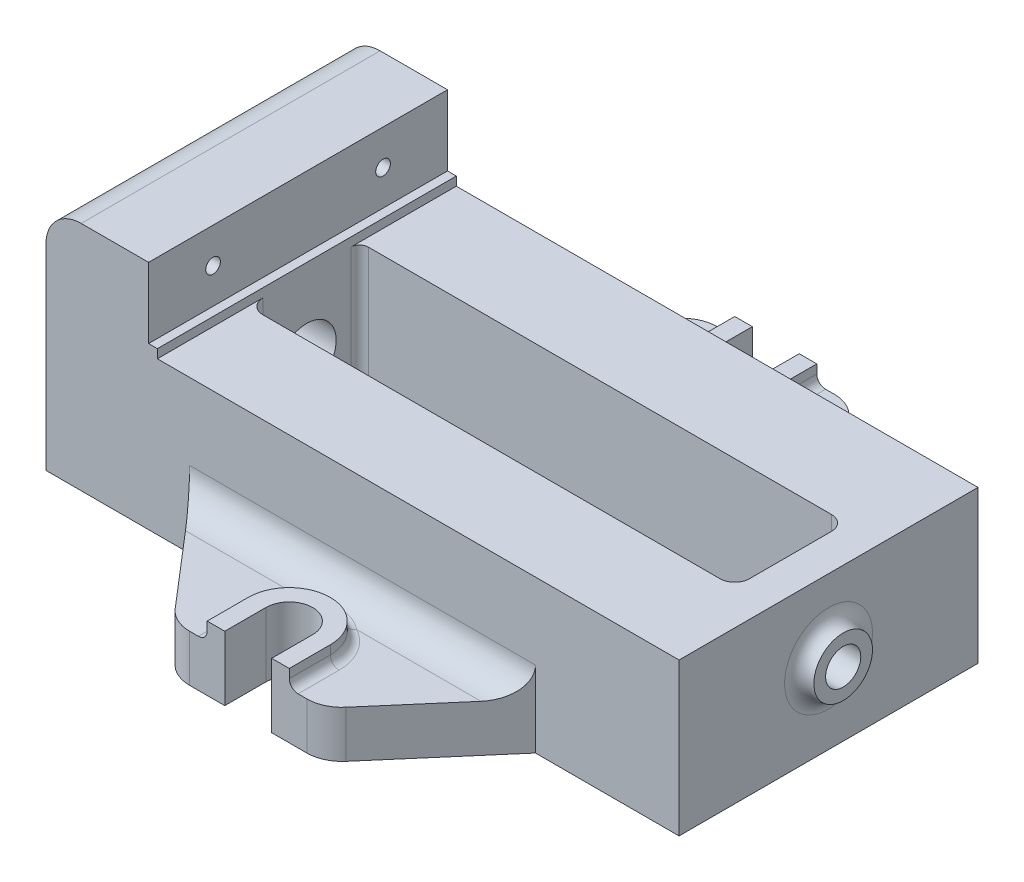
from build123d import *

# Parameters (mm, degrees)
SKETCH1_W             = 216
SKETCH1_H             = 102
EXTRUDE1_DEPTH        = 79
EXTRUDE2_DEPTH        = 169.25278601
FILLET1_R             = 12
EXTRUDE3_DEPTH        = 131.265114286
EXTRUDE4_DEPTH        = 16
EXTRUDE5_DEPTH        = 6
FILLET3_R             = 10
FILLET4_R             = 3
FILLET5_R             = 10
FILLET6_R             = 3
M6_TAPPED_HOLE1_D     = 5
M6_TAPPED_HOLE1_DEPTH = 14
M6_TAPPED_HOLE1_TIP   = 1.502151548
SKETCH13_R            = 10
SKETCH13_R_2          = 6
EXTRUDE7_DEPTH        = 5
EXTRUDE8_REACH        = 248.976
SKETCH14_R            = 6
FILLET7_R             = 5
SKETCH15_R            = 16
EXTRUDE9_DEPTH        = 5
EXTRUDE10_REACH       = 257.767
SKETCH16_R            = 10
EXTRUDE11_DEPTH       = 12


with BuildPart() as part:
    # Sketch1 → Extrude1 (new body)
    with BuildSketch(Plane(origin=(0, 0, 0), x_dir=(1, 0, 0), z_dir=(0, 1, 0))):
        Rectangle(SKETCH1_W, SKETCH1_H)
    extrude(amount=EXTRUDE1_DEPTH)

    # Sketch2 → Extrude2 (cut, through all)
    with BuildSketch(Plane.XY.offset(51)):
        Polygon((-73, 79), (-73, 55), (-70, 55), (-70, 52), (108, 52), (108, 79), align=None)
    extrude(amount=-EXTRUDE2_DEPTH, mode=Mode.SUBTRACT)

    # Fillet1
    fillet1_edges = [part.edges().sort_by_distance(p)[0] for p in [
        (-108, 79, 0),
    ]]
    fillet(fillet1_edges, radius=FILLET1_R)

    # Sketch3 → Extrude3 (cut, through all)
    with BuildSketch(Plane(origin=(0, 52, 0), x_dir=(1, 0, 0), z_dir=(0, 1, 0))):
        with BuildLine():
            Line((-65, -20), (91, -20))
            ThreePointArc((91, -20), (94.535533906, -18.535533906), (96, -15))
            Line((96, -15), (96, 13))
            ThreePointArc((96, 13), (94.535533906, 16.535533906), (91, 18))
            Line((91, 18), (-67, 18))
            ThreePointArc((-67, 18), (-69.121320344, 17.121320344), (-70, 15))
            Line((-70, 15), (-70, -15))
            ThreePointArc((-70, -15), (-68.535533906, -18.535533906), (-65, -20))
        make_face()
    extrude(amount=-EXTRUDE3_DEPTH, mode=Mode.SUBTRACT)

    # Sketch4 → Extrude4 (add)
    with BuildSketch(Plane(origin=(0, 0, 0), x_dir=(1, 0, 0), z_dir=(0, 1, 0))):
        with BuildLine():
            Line((-8, 90), (-20, 90))
            ThreePointArc((-20, 90), (-25.00957212, 88.904319657), (-29.10432929, 85.817364529))
            Line((-29.10432929, 85.817364529), (-59, 51))
            Line((-59, 51), (59, 51))
            Line((59, 51), (29.10432929, 85.817364529))
            ThreePointArc((29.10432929, 85.817364529), (25.00957212, 88.904319657), (20, 90))
            Line((20, 90), (8, 90))
            Line((8, 90), (8, 76))
            ThreePointArc((8, 76), (0, 68), (-8, 76))
            Line((-8, 76), (-8, 90))
        make_face()
        with BuildLine():
            Line((8, -90), (8, -76))
            ThreePointArc((8, -76), (0, -68), (-8, -76))
            Line((-8, -76), (-8, -90))
            Line((-8, -90), (-20, -90))
            ThreePointArc((-20, -90), (-25.00957212, -88.904319657), (-29.10432929, -85.817364529))
            Line((-29.10432929, -85.817364529), (-59, -51))
            Line((-59, -51), (59, -51))
            Line((59, -51), (29.10432929, -85.817364529))
            ThreePointArc((29.10432929, -85.817364529), (25.00957212, -88.904319657), (20, -90))
            Line((20, -90), (8, -90))
        make_face()
    extrude(amount=EXTRUDE4_DEPTH)

    # Sketch5 → Extrude5 (add)
    with BuildSketch(Plane(origin=(0, 16, 0), x_dir=(1, 0, 0), z_dir=(0, 1, 0))):
        with BuildLine():
            Line((-14, -90), (-14, -76))
            ThreePointArc((-14, -76), (0, -62), (14, -76))
            Line((14, -76), (14, -90))
            Line((14, -90), (8, -90))
            Line((8, -90), (8, -76))
            ThreePointArc((8, -76), (0, -68), (-8, -76))
            Line((-8, -76), (-8, -90))
            Line((-8, -90), (-14, -90))
        make_face()
        with BuildLine():
            Line((14, 90), (14, 76))
            ThreePointArc((14, 76), (0, 62), (-14, 76))
            Line((-14, 76), (-14, 90))
            Line((-14, 90), (-8, 90))
            Line((-8, 90), (-8, 76))
            ThreePointArc((-8, 76), (0, 68), (8, 76))
            Line((8, 76), (8, 90))
            Line((8, 90), (14, 90))
        make_face()
    extrude(amount=EXTRUDE5_DEPTH)

    # Fillet3
    fillet3_edges = [part.edges().sort_by_distance(p)[0] for p in [
        (0, 16, 51),
    ]]
    fillet(fillet3_edges, radius=FILLET3_R)

    # Fillet4
    fillet4_edges = [part.edges().sort_by_distance(p)[0] for p in [
        (14, 16, 83),
        (0, 16, 62),
        (-14, 16, 83),
    ]]
    fillet(fillet4_edges, radius=FILLET4_R)

    # Fillet5
    fillet5_edges = [part.edges().sort_by_distance(p)[0] for p in [
        (0, 16, -51),
    ]]
    fillet(fillet5_edges, radius=FILLET5_R)

    # Fillet6
    fillet6_edges = [part.edges().sort_by_distance(p)[0] for p in [
        (0, 16, -62),
        (14, 16, -83),
        (-14, 16, -83),
    ]]
    fillet(fillet6_edges, radius=FILLET6_R)

    # M6 Tapped Hole1
    with Locations(Plane(origin=(-73, 67, 29), x_dir=(0, 0, 1), z_dir=(1, 0, 0))):
        with Locations((0, 0), (-58, 0)):
            Hole(M6_TAPPED_HOLE1_D / 2, depth=M6_TAPPED_HOLE1_DEPTH)
            with Locations((0, 0, -(M6_TAPPED_HOLE1_DEPTH + M6_TAPPED_HOLE1_TIP / 2))):  # 118° drill point
                Cone(0, M6_TAPPED_HOLE1_D / 2, M6_TAPPED_HOLE1_TIP, mode=Mode.SUBTRACT)

    # Sketch13 → Extrude7 (add)
    with BuildSketch(Plane(origin=(108, 0, 0), x_dir=(0, 0, -1), z_dir=(1, 0, 0))):
        with Locations(Location((0, 27, 0), (0, 0, 180))):
            Circle(SKETCH13_R)
        with Locations((0, 27)):
            Circle(SKETCH13_R_2, mode=Mode.SUBTRACT)
    extrude(amount=EXTRUDE7_DEPTH)

    # Sketch14 → Extrude8 (cut, up to next)
    with BuildSketch(Plane(origin=(108, 0, 0), x_dir=(0, 0, -1), z_dir=(1, 0, 0)), mode=Mode.PRIVATE) as extrude8_sk1:
        with Locations((0, 27)):
            Circle(SKETCH14_R)
    extrude8_tool1 = extrude(extrude8_sk1.sketch, amount=-EXTRUDE8_REACH, mode=Mode.PRIVATE) & part.part
    add(extrude8_tool1.solids().sort_by_distance((108, 27, 0))[0], mode=Mode.SUBTRACT)

    # Fillet7
    fillet7_edges = [part.edges().sort_by_distance(p)[0] for p in [
        (108, 27, -10),
    ]]
    fillet(fillet7_edges, radius=FILLET7_R - 0.0001)  # a hair under: the kernel refuses the full size

    # Sketch15 → Extrude9 (add)
    with BuildSketch(Plane.ZY.offset(108)):
        with Locations(Location((0, 27, 0), (0, 0, 180))):
            Circle(SKETCH15_R)
    extrude(amount=EXTRUDE9_DEPTH)

    # Sketch16 → Extrude10 (cut, up to next)
    with BuildSketch(Plane.ZY.offset(113), mode=Mode.PRIVATE) as extrude10_sk1:
        with Locations((0, 27)):
            Circle(SKETCH16_R)
    extrude10_tool1 = extrude(extrude10_sk1.sketch, amount=-EXTRUDE10_REACH, mode=Mode.PRIVATE) & part.part
    add(extrude10_tool1.solids().sort_by_distance((-113, 27, 0))[0], mode=Mode.SUBTRACT)

    # Sketch17 → Extrude11 (cut)
    with BuildSketch(Plane.XZ):
        with BuildLine():
            Line((-64, -28), (90, -28))
            ThreePointArc((90, -28), (94.242640687, -26.242640687), (96, -22))
            Line((96, -22), (96, 22))
            ThreePointArc((96, 22), (94.242640687, 26.242640687), (90, 28))
            Line((90, 28), (-64, 28))
            ThreePointArc((-64, 28), (-68.242640687, 26.242640687), (-70, 22))
            Line((-70, 22), (-70, -22))
            ThreePointArc((-70, -22), (-68.242640687, -26.242640687), (-64, -28))
        make_face()
    extrude(amount=-EXTRUDE11_DEPTH, mode=Mode.SUBTRACT)


solid = part.part
